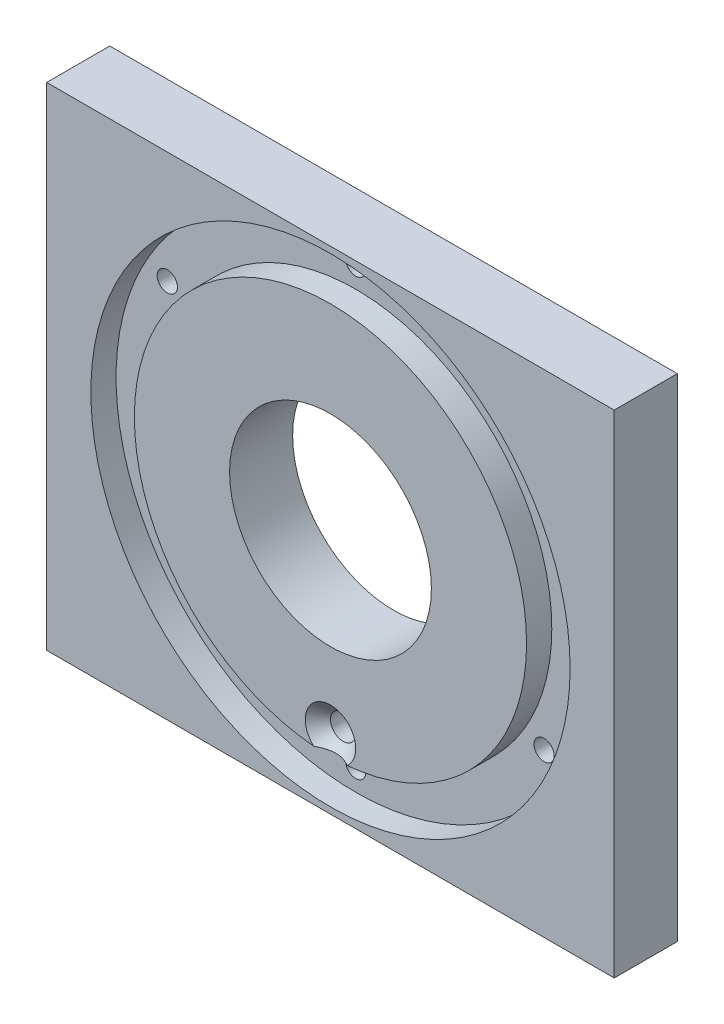
from build123d import *

# Parameters (mm, degrees)
SKETCH_1_W                = 90
SKETCH_1_H                = 78
SKETCH_1_R                = 16
EXTRUDE_1_DEPTH           = 10
SKETCH_2_R                = 38
SKETCH_2_R_2              = 31.1
CUT_EXTRUDE_1_DEPTH       = 4
HOLE_WIZARD_1_D           = 3.2
HOLE_WIZARD_1_DEPTH       = 8.5
HOLE_WIZARD_1_CBORE_D     = 6
HOLE_WIZARD_1_CBORE_DEPTH = 3.4
HOLE_WIZARD_1_TIP         = 0.96137699
HOLE_WIZARD_4_0_4_1_D     = 4
CHAMFER_1_SIZE            = 2


with BuildPart() as part:
    # 草图1 → 凸台-拉伸1 (new body)
    with BuildSketch(Plane.XY):
        Rectangle(SKETCH_1_W, SKETCH_1_H)
        Circle(SKETCH_1_R, mode=Mode.SUBTRACT)
    extrude(amount=EXTRUDE_1_DEPTH)

    # 草图2 → 切除-拉伸1 (cut)
    with BuildSketch(Plane.XY.offset(10)):
        Circle(SKETCH_2_R)
        Circle(SKETCH_2_R_2, mode=Mode.SUBTRACT)
    extrude(amount=-CUT_EXTRUDE_1_DEPTH, mode=Mode.SUBTRACT)

    # 打孔尺寸(%根据)内六角圆柱头螺钉的类型1
    with Locations(Plane(origin=(0, 0, 0), x_dir=(-1, 0, 0), z_dir=(0, 0, -1))):
        with Locations((0, 34.5), (29.877876431, 17.25), (29.877876431, -17.25), (0, -34.5), (-29.877876431, -17.25), (-29.877876431, 17.25)):
            CounterBoreHole(HOLE_WIZARD_1_D / 2, HOLE_WIZARD_1_CBORE_D / 2, HOLE_WIZARD_1_CBORE_DEPTH, depth=HOLE_WIZARD_1_DEPTH)
            with Locations((0, 0, -(HOLE_WIZARD_1_DEPTH + HOLE_WIZARD_1_TIP / 2))):  # 118° drill point
                Cone(0, HOLE_WIZARD_1_D / 2, HOLE_WIZARD_1_TIP, mode=Mode.SUBTRACT)

    # Ø4.0 (4) 直径孔1 (through all)
    with Locations(Plane(origin=(0, 0, 0), x_dir=(-1, 0, 0), z_dir=(0, 0, -1))):
        with Locations((0, -28)):
            Hole(HOLE_WIZARD_4_0_4_1_D / 2)

    # 倒角1
    # the kernel refuses this chamfer: 2 mm, written as the material it takes off along each edge
    with BuildSketch(Plane(origin=(0, -28, 0), x_dir=(1, 0, 0), z_dir=(0, -1, 0))) as chamfer_1_piece_1:
        Polygon((2 + CHAMFER_1_SIZE, 0), (2, CHAMFER_1_SIZE), (2, 0), align=None)
    revolve(axis=Axis((0, -28, 0), (0, 0, 1)), mode=Mode.SUBTRACT)
    with BuildSketch(Plane(origin=(0, -28, 10), x_dir=(1, 0, 0), z_dir=(0, -1, 0))) as chamfer_1_piece_2:
        Polygon((2, -CHAMFER_1_SIZE), (2 + CHAMFER_1_SIZE, 0), (2, 0), align=None)
    revolve(axis=Axis((0, -28, 10), (0, 0, 1)), mode=Mode.SUBTRACT)


solid = part.part
